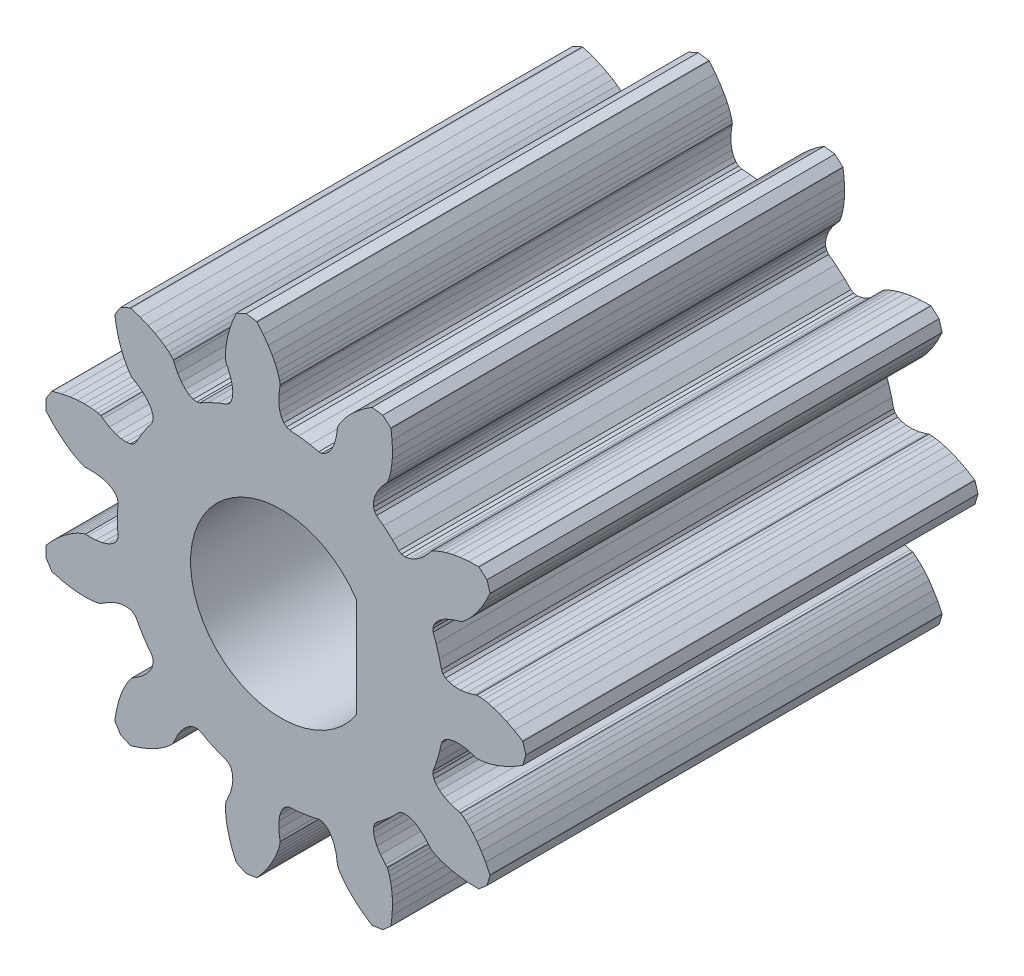
from build123d import *

# Parameters (mm, degrees)
BOSS_EXTRUDE1_DEPTH = 15


with BuildPart() as part:
    # Model → Boss-Extrude1 (new body)
    with BuildSketch(Plane.XY):
        Polygon((6.544826042, -4.62784489), (6.564836516, -4.626964885), (6.835184946, -4.392706637), (6.935966948, -4.049474661), (6.928454776, -4.030906927), (6.788634009, -3.745727548), (6.645518017, -3.49992033), (6.503926801, -3.292356123), (6.368492253, -3.121425138), (6.243614635, -2.985058743), (6.133421249, -2.880754988), (6.041727611, -2.805607643), (5.972001435, -2.756338525), (5.95213003, -2.744325557), (5.873217122, -2.729414946), (5.628520065, -2.651828061), (5.424999994, -2.555731678), (5.263872444, -2.446611875), (5.145780041, -2.330021086), (5.070790124, -2.211524358), (5.038397136, -2.096645662), (5.047529717, -1.990814665), (5.150662463, -1.714305072), (5.259836289, -1.342493166), (5.322567874, -1.054120722), (5.372101615, -0.960152576), (5.461460443, -0.881023439), (5.588610143, -0.821880258), (5.750989534, -0.787643418), (5.945533274, -0.782958127), (6.16869888, -0.812147965), (6.416497781, -0.87917094), (6.490944828, -0.909290875), (6.514156418, -0.909928216), (6.599450707, -0.906177213), (6.717216026, -0.892532567), (6.866307468, -0.864361707), (7.045086445, -0.817156933), (7.251433504, -0.746582082), (7.482765298, -0.648517951), (7.736055546, -0.519106107), (8.007859874, -0.354790761), (8.024217989, -0.343231976), (8.124999991, 0), (8.024217989, 0.343231976), (8.007859874, 0.354790761), (7.736055546, 0.519106107), (7.482765298, 0.648517951), (7.251433504, 0.746582082), (7.045086445, 0.817156933), (6.866307468, 0.864361707), (6.717216026, 0.892532567), (6.599450707, 0.906177213), (6.514156418, 0.909928216), (6.490944828, 0.909290875), (6.416497781, 0.87917094), (6.16869888, 0.812147965), (5.945533274, 0.782958129), (5.750989534, 0.787643418), (5.588610143, 0.821880258), (5.461460443, 0.881023439), (5.372101615, 0.960152576), (5.322567874, 1.054120722), (5.259836289, 1.342493166), (5.150662463, 1.714305072), (5.047529717, 1.990814665), (5.038397136, 2.096645662), (5.070790124, 2.211524358), (5.145780041, 2.330021086), (5.263872444, 2.446611875), (5.424999994, 2.555731679), (5.628520065, 2.651828061), (5.873217122, 2.729414946), (5.95213003, 2.744325557), (5.972001435, 2.756338525), (6.041727611, 2.805607643), (6.133421249, 2.880754988), (6.243614635, 2.985058743), (6.368492253, 3.121425138), (6.503926801, 3.292356123), (6.645518017, 3.49992033), (6.788634009, 3.745727548), (6.928454776, 4.030906927), (6.935966948, 4.049474661), (6.835184946, 4.392706637), (6.564836516, 4.626964885), (6.544826042, 4.62784489), (6.227334108, 4.619127241), (5.944287467, 4.591056365), (5.696661306, 4.548485752), (5.484915468, 4.496297451), (5.308996195, 4.439353423), (5.168342176, 4.382447338), (5.061894833, 4.330257207), (4.988112766, 4.287299177), (4.968930506, 4.274213879), (4.922585731, 4.208626265), (4.750359386, 4.01827275), (4.578401749, 3.873064261), (4.412208082, 3.771827491), (4.257096012, 3.712840427), (4.11815566, 3.693852519), (4.000201789, 3.712109156), (3.907728339, 3.764380228), (3.699049257, 3.97305931), (3.406189698, 4.226823562), (3.169936538, 4.403680462), (3.105037166, 4.487773716), (3.07017977, 4.601928797), (3.069201134, 4.742157197), (3.105513046, 4.904085185), (3.182067546, 5.082994735), (3.301325899, 5.273867414), (3.465231525, 5.471430872), (3.523556004, 5.526638015), (3.533778192, 5.547487259), (3.565798688, 5.626631896), (3.602308562, 5.739423189), (3.638618271, 5.886744133), (3.669946768, 6.068976782), (3.691469293, 6.285994522), (3.698365721, 6.537158636), (3.685869139, 6.821319172), (3.649314242, 7.136820147), (3.645595407, 7.156501705), (3.375246977, 7.390759954), (3.021165834, 7.441669137), (3.003856185, 7.431590964), (2.741478091, 7.252608113), (2.518540366, 7.075966822), (2.333239394, 6.906277333), (2.183322585, 6.747895298), (2.066116142, 6.604881793), (1.978556203, 6.480966044), (1.917223115, 6.379511134), (1.878378554, 6.303482942), (1.869315857, 6.282104177), (1.865787493, 6.201872487), (1.823814352, 5.948624328), (1.757660018, 5.733499857), (1.672581738, 5.558482986), (1.573983976, 5.424999994), (1.467365553, 5.333909524), (1.358266158, 5.285497306), (1.252212667, 5.279475609), (0.963840223, 5.342207195), (0.580275771, 5.397355437), (0.285910907, 5.418408828), (0.185849835, 5.454065325), (0.094809031, 5.531253359), (0.018172553, 5.648691906), (-0.038824802, 5.804546099), (-0.071148864, 5.996442878), (-0.074015914, 6.221491126), (-0.042940597, 6.476306155), (-0.023722158, 6.554281953), (-0.026394658, 6.577347985), (-0.042246125, 6.661240278), (-0.07251164, 6.77586508), (-0.121613685, 6.919429855), (-0.193780884, 7.089671179), (-0.293003633, 7.283874075), (-0.42299156, 7.498895264), (-0.587133138, 7.731190157), (-0.78845778, 7.976843396), (-0.802226917, 7.991390023), (-1.15630806, 8.042299206), (-1.481703654, 7.893696017), (-1.490816786, 7.875859417), (-1.61477785, 7.583437153), (-1.706825506, 7.314307809), (-1.770969539, 7.071374659), (-1.811459792, 6.857084066), (-1.832741188, 6.673406862), (-1.839407384, 6.521823824), (-1.836153395, 6.403315351), (-1.827727576, 6.318355411), (-1.823793369, 6.295470785), (-1.783385091, 6.226068015), (-1.681778853, 5.990329714), (-1.62112635, 5.773589759), (-1.598077489, 5.580359408), (-1.608856851, 5.414760394), (-1.64930275, 5.280487942), (-1.71490938, 5.180777408), (-1.800871679, 5.118374788), (-2.077381272, 5.015242041), (-2.429871614, 4.854265096), (-2.688889418, 4.712830675), (-2.792343506, 4.68872973), (-2.910662905, 4.704444061), (-3.038625685, 4.761806846), (-3.170836049, 4.86210464), (-3.301776013, 5.006062775), (-3.425858198, 5.193835365), (-3.537479382, 5.424999994), (-3.563468702, 5.500987681), (-3.578187391, 5.518947199), (-3.636878091, 5.580951938), (-3.724309909, 5.661017684), (-3.843234156, 5.755245489), (-3.995984475, 5.859445071), (-4.184449976, 5.969175075), (-4.41005201, 6.07978563), (-4.673724793, 6.186462893), (-4.975900027, 6.284275229), (-4.995347863, 6.289068473), (-5.320743457, 6.140465285), (-5.514142701, 5.839530187), (-5.512165961, 5.819598153), (-5.458353232, 5.50657848), (-5.39028634, 5.230407748), (-5.312908158, 4.991360494), (-5.231116484, 4.789197093), (-5.149716141, 4.623172405), (-5.073372124, 4.49204862), (-5.006564177, 4.394112188), (-4.953543115, 4.327194681), (-4.937861086, 4.310069901), (-4.86634551, 4.27353094), (-4.653419155, 4.130147741), (-4.485216556, 3.980605707), (-4.361358405, 3.830511146), (-4.280896995, 3.685372628), (-4.242329083, 3.55054875), (-4.243613307, 3.431197288), (-4.282191991, 3.332226136), (-4.459048891, 3.095972976), (-4.668551929, 2.769979886), (-4.809986351, 2.510962082), (-4.883987513, 2.434755574), (-4.992019935, 2.384007014), (-5.130681738, 2.363081757), (-5.296129256, 2.375979311), (-5.484112606, 2.426293113), (-5.690014709, 2.517173574), (-5.908893459, 2.651294665), (-5.971839112, 2.701168689), (-5.993930909, 2.708319673), (-6.07682696, 2.72875079), (-6.193666097, 2.748837172), (-6.344654937, 2.763811344), (-6.52949123, 2.768886553), (-6.747363017, 2.759305164), (-6.996952106, 2.730387017), (-7.276441849, 2.677577371), (-7.583529174, 2.59649408), (-7.602481158, 2.59001212), (-7.795880402, 2.289077022), (-7.795880402, 1.931354782), (-7.783441391, 1.915655594), (-7.568940031, 1.681420046), (-7.362369347, 1.485890183), (-7.168035975, 1.32662464), (-6.989930654, 1.200773882), (-6.831692604, 1.105113374), (-6.696577061, 1.036079719), (-6.587426206, 0.989809453), (-6.506643715, 0.962180214), (-6.484192798, 0.956252277), (-6.404275613, 0.964177986), (-6.147631755, 0.958673042), (-5.925282196, 0.923807468), (-5.739938844, 0.864502661), (-5.593782591, 0.785905092), (-5.488445907, 0.693335416), (-5.424999994, 0.592236273), (-5.403946603, 0.48811923), (-5.424999994, 0.193754366), (-5.424999994, -0.193754366), (-5.403946603, -0.48811923), (-5.424999994, -0.592236273), (-5.488445907, -0.693335416), (-5.593782591, -0.785905092), (-5.739938844, -0.864502661), (-5.925282196, -0.92380747), (-6.147631755, -0.958673042), (-6.404275613, -0.964177986), (-6.484192798, -0.956252277), (-6.506643715, -0.962180214), (-6.587426206, -0.989809453), (-6.696577061, -1.036079719), (-6.831692604, -1.105113374), (-6.989930654, -1.200773882), (-7.168035975, -1.32662464), (-7.362369347, -1.485890183), (-7.568940031, -1.681420046), (-7.783441391, -1.915655594), (-7.795880402, -1.931354782), (-7.795880402, -2.289077022), (-7.602481158, -2.59001212), (-7.583529174, -2.59649408), (-7.276441849, -2.677577371), (-6.996952106, -2.730387017), (-6.747363017, -2.759305164), (-6.52949123, -2.768886553), (-6.344654937, -2.763811344), (-6.193666097, -2.748837172), (-6.07682696, -2.72875079), (-5.993930909, -2.708319673), (-5.971839112, -2.701168689), (-5.908893459, -2.651294665), (-5.690014709, -2.517173574), (-5.484112605, -2.426293114), (-5.296129256, -2.375979311), (-5.130681738, -2.363081757), (-4.992019935, -2.384007014), (-4.883987513, -2.434755574), (-4.809986351, -2.510962082), (-4.668551929, -2.769979886), (-4.459048891, -3.095972976), (-4.282191991, -3.332226136), (-4.243613307, -3.431197288), (-4.242329083, -3.55054875), (-4.280896995, -3.685372628), (-4.361358405, -3.830511146), (-4.485216555, -3.980605708), (-4.653419155, -4.130147741), (-4.86634551, -4.27353094), (-4.937861086, -4.310069901), (-4.953543115, -4.327194681), (-5.006564177, -4.394112188), (-5.073372124, -4.49204862), (-5.149716141, -4.623172405), (-5.231116484, -4.789197093), (-5.312908158, -4.991360494), (-5.39028634, -5.230407748), (-5.458353232, -5.50657848), (-5.512165961, -5.819598153), (-5.514142701, -5.839530187), (-5.320743457, -6.140465285), (-4.995347863, -6.289068473), (-4.975900027, -6.284275229), (-4.673724793, -6.186462893), (-4.41005201, -6.07978563), (-4.184449976, -5.969175075), (-3.995984475, -5.859445071), (-3.843234156, -5.755245489), (-3.724309909, -5.661017684), (-3.636878091, -5.580951938), (-3.578187391, -5.518947199), (-3.563468702, -5.500987681), (-3.537479382, -5.424999994), (-3.425858198, -5.193835365), (-3.301776011, -5.006062776), (-3.17083605, -4.862104639), (-3.038625685, -4.761806846), (-2.910662905, -4.704444061), (-2.792343506, -4.68872973), (-2.688889418, -4.712830675), (-2.429871614, -4.854265096), (-2.077381272, -5.015242041), (-1.800871679, -5.118374788), (-1.71490938, -5.180777408), (-1.64930275, -5.280487942), (-1.608856851, -5.414760394), (-1.598077489, -5.580359408), (-1.621126349, -5.773589759), (-1.681778853, -5.990329714), (-1.783385091, -6.226068015), (-1.823793369, -6.295470785), (-1.827727576, -6.318355411), (-1.836153395, -6.403315351), (-1.839407384, -6.521823824), (-1.832741188, -6.673406862), (-1.811459792, -6.857084066), (-1.770969539, -7.071374659), (-1.706825506, -7.314307809), (-1.61477785, -7.583437153), (-1.490816786, -7.875859417), (-1.481703654, -7.893696017), (-1.15630806, -8.042299206), (-0.802226917, -7.991390023), (-0.78845778, -7.976843396), (-0.587133138, -7.731190157), (-0.42299156, -7.498895264), (-0.293003633, -7.283874075), (-0.193780884, -7.089671179), (-0.121613685, -6.919429855), (-0.07251164, -6.77586508), (-0.042246125, -6.661240278), (-0.026394658, -6.577347985), (-0.023722158, -6.554281953), (-0.042940597, -6.476306155), (-0.074015914, -6.221491126), (-0.071148863, -5.996442878), (-0.038824802, -5.804546099), (0.018172553, -5.648691906), (0.094809031, -5.531253359), (0.185849835, -5.454065325), (0.285910907, -5.418408828), (0.580275771, -5.397355437), (0.963840223, -5.342207195), (1.252212667, -5.279475609), (1.358266158, -5.285497306), (1.467365553, -5.333909524), (1.573983976, -5.424999994), (1.672581738, -5.558482986), (1.757660019, -5.733499856), (1.823814352, -5.948624328), (1.865787493, -6.201872487), (1.869315857, -6.282104177), (1.878378554, -6.303482942), (1.917223115, -6.379511134), (1.978556203, -6.480966044), (2.066116142, -6.604881793), (2.183322585, -6.747895298), (2.333239394, -6.906277333), (2.518540366, -7.075966822), (2.741478091, -7.252608113), (3.003856185, -7.431590964), (3.021165834, -7.441669137), (3.375246977, -7.390759954), (3.645595407, -7.156501705), (3.649314242, -7.136820147), (3.685869139, -6.821319172), (3.698365721, -6.537158636), (3.691469293, -6.285994522), (3.669946768, -6.068976782), (3.638618271, -5.886744133), (3.602308562, -5.739423189), (3.565798688, -5.626631896), (3.533778192, -5.547487259), (3.523556004, -5.526638015), (3.465231525, -5.471430872), (3.301325899, -5.273867414), (3.182067547, -5.082994734), (3.105513046, -4.904085185), (3.069201134, -4.742157197), (3.07017977, -4.601928797), (3.105037166, -4.487773716), (3.169936538, -4.403680462), (3.406189698, -4.226823562), (3.699049257, -3.97305931), (3.907728339, -3.764380228), (4.000201789, -3.712109156), (4.11815566, -3.693852519), (4.257096012, -3.712840427), (4.412208082, -3.771827491), (4.57840175, -3.87306426), (4.750359386, -4.01827275), (4.922585731, -4.208626265), (4.968930506, -4.274213879), (4.988112766, -4.287299177), (5.061894833, -4.330257207), (5.168342176, -4.382447338), (5.308996195, -4.439353423), (5.484915468, -4.496297451), (5.696661306, -4.548485752), (5.944287467, -4.591056365), (6.227334108, -4.619127241), align=None)
        with BuildLine():
            ThreePointArc((2.5, -1.658312395), (-3, 0), (2.5, 1.658312395))
            Line((2.5, 1.658312395), (2.5, -1.658312395))
        make_face(mode=Mode.SUBTRACT)
    extrude(amount=BOSS_EXTRUDE1_DEPTH)


solid = part.part
